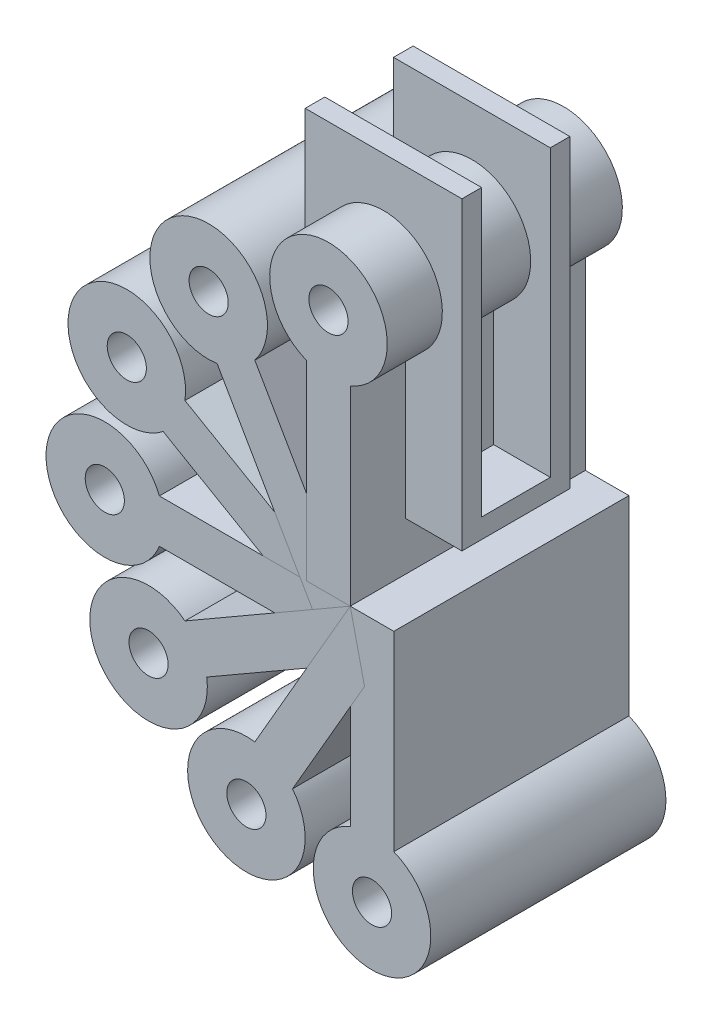
from build123d import *

# Parameters (mm, degrees)
EXTRUDE_5_DEPTH         = 30
EXTRUDE_5_DEPTH_BACK    = 30
F_1_FR_R                = 5
EXTRUDE_6_DEPTH         = 20
EXTRUDE_6_DEPTH_BACK    = 20
MOVE_START              = -30
MOVE_BODY_2_OUTLINE_R   = 5
MOVE_BODY_2_DEPTH       = 60
MOVE_BODY_2_2_OUTLINE_R = 5
MOVE_BODY_2_2_DEPTH     = 60
MOVE_BODY_2_3_OUTLINE_R = 5
MOVE_BODY_2_3_DEPTH     = 60
MOVE_BODY_2_4_OUTLINE_R = 5
MOVE_BODY_2_4_DEPTH     = 60
MOVE_BODY_2_5_OUTLINE_R = 5
MOVE_BODY_2_5_DEPTH     = 60
MOVE_BODY_2_6_OUTLINE_R = 5
MOVE_BODY_2_6_DEPTH     = 60


# Read off the part's stored shape, not the designer's step: Тело-Переместить/Копировать2
with BuildPart() as part:
    # Эскиз1_fr → Бобышка-Вытянуть5 (new, two sides: drawn at the far end of the back side and taken through both)
    with BuildSketch(Plane.XY.offset(-EXTRUDE_5_DEPTH_BACK)):
        with BuildLine():
            Line((-5.557606452, -13.932444528), (-5.557606452, -62.642280008))
            Line((-5.557606452, -62.642280008), (5.557606452, -62.642280008))
            Line((5.557606452, -62.642280008), (5.557606452, -13.932444528))
            ThreePointArc((5.557606452, -13.932444528), (0, 15), (-5.557606452, -13.932444528))
        make_face()
        Circle(F_1_FR_R, mode=Mode.SUBTRACT)
    extrude(amount=EXTRUDE_5_DEPTH + EXTRUDE_5_DEPTH_BACK)


with BuildPart() as body_2:
    # Эскиз3 → Бобышка-Вытянуть6 (new, two sides: drawn at the far end of the back side and taken through both)
    with BuildSketch(Plane(origin=(0, 0, 0), x_dir=(0, 0, -1), z_dir=(1, 0, 0)).offset(-EXTRUDE_6_DEPTH_BACK)):
        Polygon((-58.394498043, -50.25314581), (-85.938130262, -50.25314581), (-85.938130262, 27.580465306), (-80.938130262, 27.580465306), (-80.938130262, -45.25314581), (-63.394498043, -45.25314581), (-63.394498043, 27.580465306), (-58.394498043, 27.580465306), align=None)
    extrude(amount=EXTRUDE_6_DEPTH + EXTRUDE_6_DEPTH_BACK)


with BuildPart() as body_2_1:
    # Move Body 1: moved
    add(body_2.part.moved(Location((0, 0, -70))))


with BuildPart() as body_3:
    # Move Body 2 outline → Move Body 2 (new body)
    with BuildSketch(Plane.XY.offset(MOVE_START)):
        with BuildLine():
            Line((5.557606452, -62.642280008), (5.557606452, -111.352115487))
            ThreePointArc((5.557606452, -111.352115487), (11.115212904, -140.284560015), (16.672819356, -111.352115487))
            Line((16.672819356, -111.352115487), (16.672819356, -62.642280008))
            Line((16.672819356, -62.642280008), (5.557606452, -62.642280008))
        make_face()
        with Locations((11.115212904, -125.284560015)):
            Circle(MOVE_BODY_2_OUTLINE_R, mode=Mode.SUBTRACT)
    extrude(amount=MOVE_BODY_2_DEPTH)


with BuildPart() as body_4:
    # Move Body 2 2 outline → Move Body 2 2 (new body)
    with BuildSketch(Plane.XY.offset(MOVE_START)):
        with BuildLine():
            Line((5.557606452, -62.642280008), (-18.797311288, -104.826234947))
            ThreePointArc((-18.797311288, -104.826234947), (-28.450505179, -132.661270128), (-9.171254544, -110.383841399))
            Line((-9.171254544, -110.383841399), (15.183663196, -68.19988646))
            Line((15.183663196, -68.19988646), (5.557606452, -62.642280008))
        make_face()
        with Locations((-20.95050518, -119.670889071)):
            Circle(MOVE_BODY_2_2_OUTLINE_R, mode=Mode.SUBTRACT)
    extrude(amount=MOVE_BODY_2_2_DEPTH)


with BuildPart() as body_5:
    # Move Body 2 3 outline → Move Body 2 3 (new body)
    with BuildSketch(Plane.XY.offset(MOVE_START)):
        with BuildLine():
            Line((5.557606452, -62.642280008), (-36.626348487, -86.997197747))
            ThreePointArc((-36.626348487, -86.997197747), (-58.903777216, -106.276448382), (-31.068742035, -96.623254491))
            Line((-31.068742035, -96.623254491), (11.115212904, -72.268336751))
            Line((11.115212904, -72.268336751), (5.557606452, -62.642280008))
        make_face()
        with Locations((-45.913396159, -98.776448383)):
            Circle(MOVE_BODY_2_3_OUTLINE_R, mode=Mode.SUBTRACT)
    extrude(amount=MOVE_BODY_2_3_DEPTH)


with BuildPart() as body_6:
    # Move Body 2 4 outline → Move Body 2 4 (new body)
    with BuildSketch(Plane.XY.offset(MOVE_START)):
        with BuildLine():
            Line((5.557606452, -62.642280008), (-43.152229028, -62.642280008))
            ThreePointArc((-43.152229028, -62.642280008), (-72.084673555, -68.19988646), (-43.152229028, -73.757492912))
            Line((-43.152229028, -73.757492912), (5.557606452, -73.757492912))
            Line((5.557606452, -73.757492912), (5.557606452, -62.642280008))
        make_face()
        with Locations((-57.084673555, -68.19988646)):
            Circle(MOVE_BODY_2_4_OUTLINE_R, mode=Mode.SUBTRACT)
    extrude(amount=MOVE_BODY_2_4_DEPTH)


with BuildPart() as body_7:
    # Move Body 2 5 outline → Move Body 2 5 (new body)
    with BuildSketch(Plane.XY.offset(MOVE_START)):
        with BuildLine():
            Line((5.557606452, -62.642280008), (-36.626348487, -38.287362268))
            ThreePointArc((-36.626348487, -38.287362268), (-64.461383667, -28.634168373), (-42.18395494, -47.913419011))
            Line((-42.18395494, -47.913419011), (0, -72.268336751))
            Line((0, -72.268336751), (5.557606452, -62.642280008))
        make_face()
        with Locations((-51.471002611, -36.134168376)):
            Circle(MOVE_BODY_2_5_OUTLINE_R, mode=Mode.SUBTRACT)
    extrude(amount=MOVE_BODY_2_5_DEPTH)


with BuildPart() as body_8:
    # Move Body 2 6 outline → Move Body 2 6 (new body)
    with BuildSketch(Plane.XY.offset(MOVE_START)):
        with BuildLine():
            Line((5.557606452, -62.642280008), (-18.797311288, -20.458325068))
            ThreePointArc((-18.797311288, -20.458325068), (-38.076561924, 1.819103661), (-28.423368031, -26.01593152))
            Line((-28.423368031, -26.01593152), (-4.068450291, -68.19988646))
            Line((-4.068450291, -68.19988646), (5.557606452, -62.642280008))
        make_face()
        with Locations((-30.576561923, -11.171277396)):
            Circle(MOVE_BODY_2_6_OUTLINE_R, mode=Mode.SUBTRACT)
    extrude(amount=MOVE_BODY_2_6_DEPTH)


solid = Compound([part.part, body_2_1.part, body_3.part, body_4.part, body_5.part, body_6.part, body_7.part, body_8.part])
